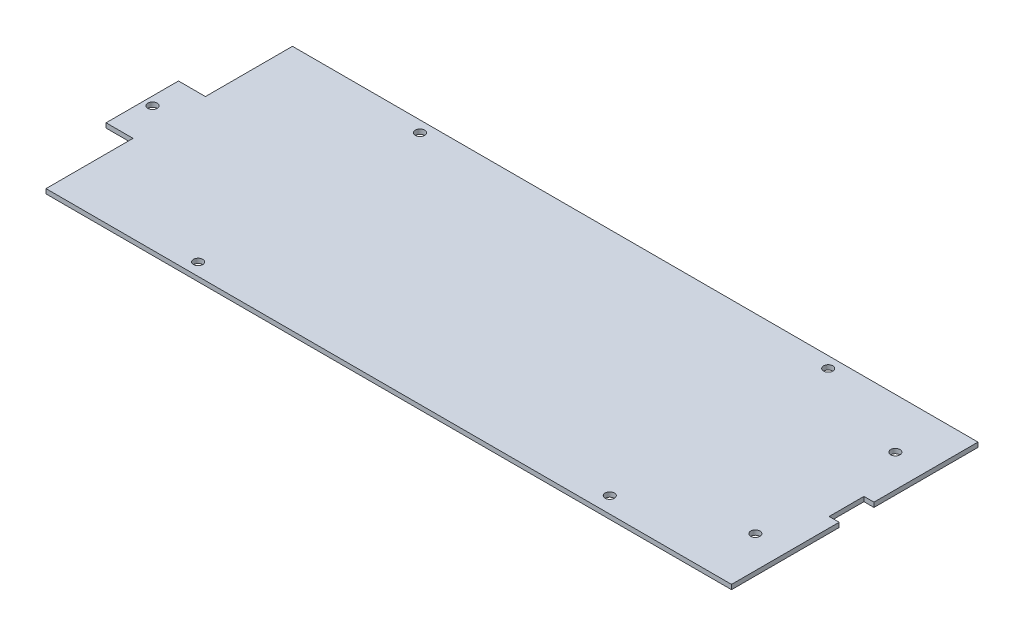
from build123d import *

# Parameters (mm, degrees)
BOSS_EXTRUDE1_START = 2
SKETCH1_R           = 3
BOSS_EXTRUDE1_DEPTH = 3


with BuildPart() as part:
    # Sketch1 → Boss-Extrude1 (new body)
    with BuildSketch(Plane(origin=(0, 0, 0), x_dir=(1, 0, 0), z_dir=(0, 1, 0)).offset(BOSS_EXTRUDE1_START)):
        Polygon((-284.735528935, 23.500003974), (-302.235528935, 23.500003974), (-302.235528935, -23.499996026), (-284.735528935, -23.499996026), (-284.735528935, -79.999996026), (160.264471065, -79.999996026), (160.264471065, -10.137904614), (153.764471065, -10.137904614), (153.764471065, 12.462095386), (160.264471065, 12.462095386), (160.264471065, 80.000003974), (-284.735528935, 80.000003974), align=None)
        with Locations((-194.12652749, -71.865802603)):
            Circle(SKETCH1_R, mode=Mode.SUBTRACT)
        with Locations((70.864076761, -69.634287707)):
            Circle(SKETCH1_R, mode=Mode.SUBTRACT)
        with Locations((139.486711057, -43.781888876)):
            Circle(SKETCH1_R, mode=Mode.SUBTRACT)
        with Locations((-296.74646616, 1.162092537)):
            Circle(SKETCH1_R, mode=Mode.SUBTRACT)
        with Locations((-194.735528935, 72.773627962)):
            Circle(SKETCH1_R, mode=Mode.SUBTRACT)
        with Locations((139.102370463, 47.500003974)):
            Circle(SKETCH1_R, mode=Mode.SUBTRACT)
        with Locations((70.264471065, 72.773627962)):
            Circle(SKETCH1_R, mode=Mode.SUBTRACT)
    extrude(amount=BOSS_EXTRUDE1_DEPTH)


solid = part.part
